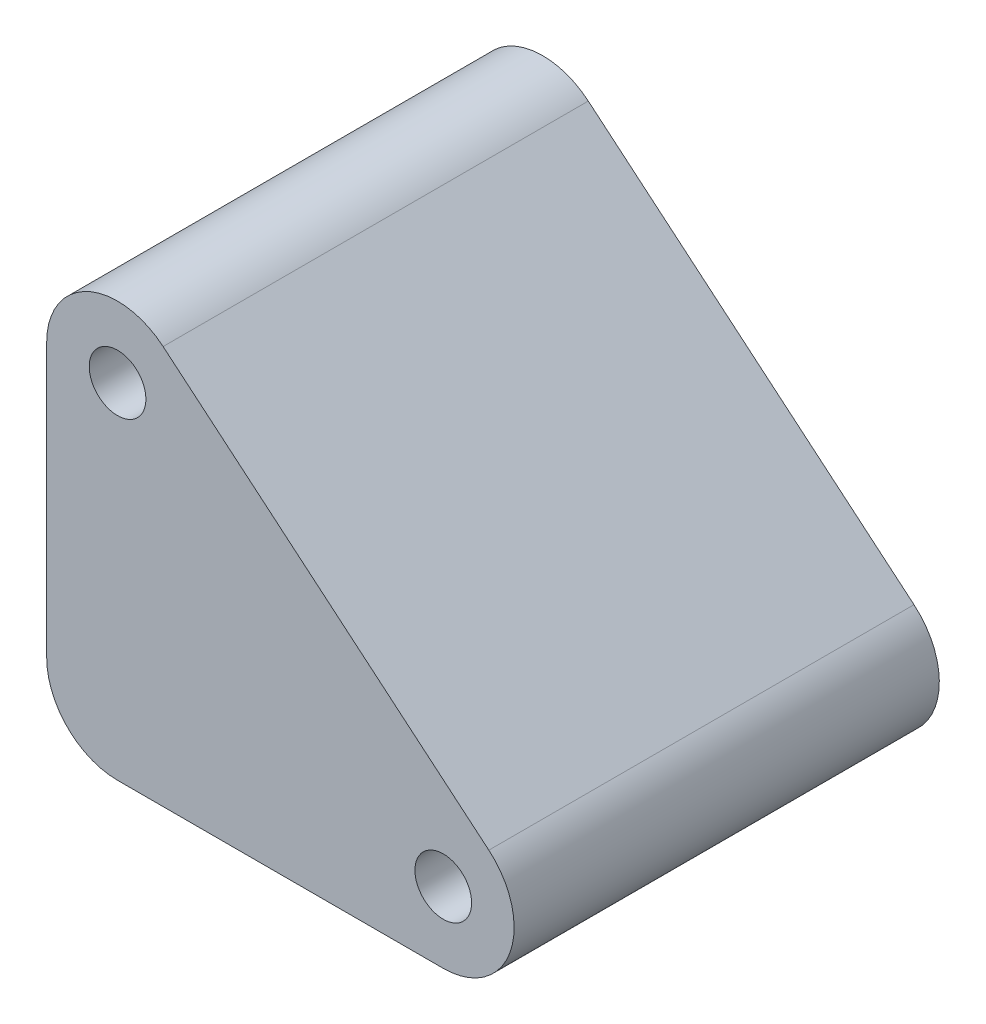
from build123d import *

# Parameters (mm, degrees)
BOSS_EXTRUDE1_DEPTH      = 15
BOSS_EXTRUDE1_DEPTH_BACK = 15
SKETCH1_R                = 2


with BuildPart() as part:
    # Sketch1 → Boss-Extrude1 (new, two sides: drawn at the far end of the back side and taken through both)
    with BuildSketch(Plane.XY.offset(-BOSS_EXTRUDE1_DEPTH_BACK)):
        with BuildLine():
            Line((-269.744140328, 37.981077893), (-246.762807034, 18.697449603))
            ThreePointArc((-246.762807034, 18.697449603), (-245.278281978, 13.15712667), (-249.976745082, 9.867227387))
            Line((-249.976745082, 9.867227387), (-272.958078376, 9.867227387))
            ThreePointArc((-272.958078376, 9.867227387), (-276.493612282, 11.331693481), (-277.958078376, 14.867227387))
            Line((-277.958078376, 14.867227387), (-277.958078376, 34.150855678))
            ThreePointArc((-277.958078376, 34.150855678), (-275.071169685, 38.682394613), (-269.744140328, 37.981077893))
        make_face()
        with Locations((-249.976745082, 14.867227387)):
            Circle(SKETCH1_R, mode=Mode.SUBTRACT)
        with Locations((-272.958078376, 34.150855678)):
            Circle(SKETCH1_R, mode=Mode.SUBTRACT)
    extrude(amount=BOSS_EXTRUDE1_DEPTH + BOSS_EXTRUDE1_DEPTH_BACK)


solid = part.part
